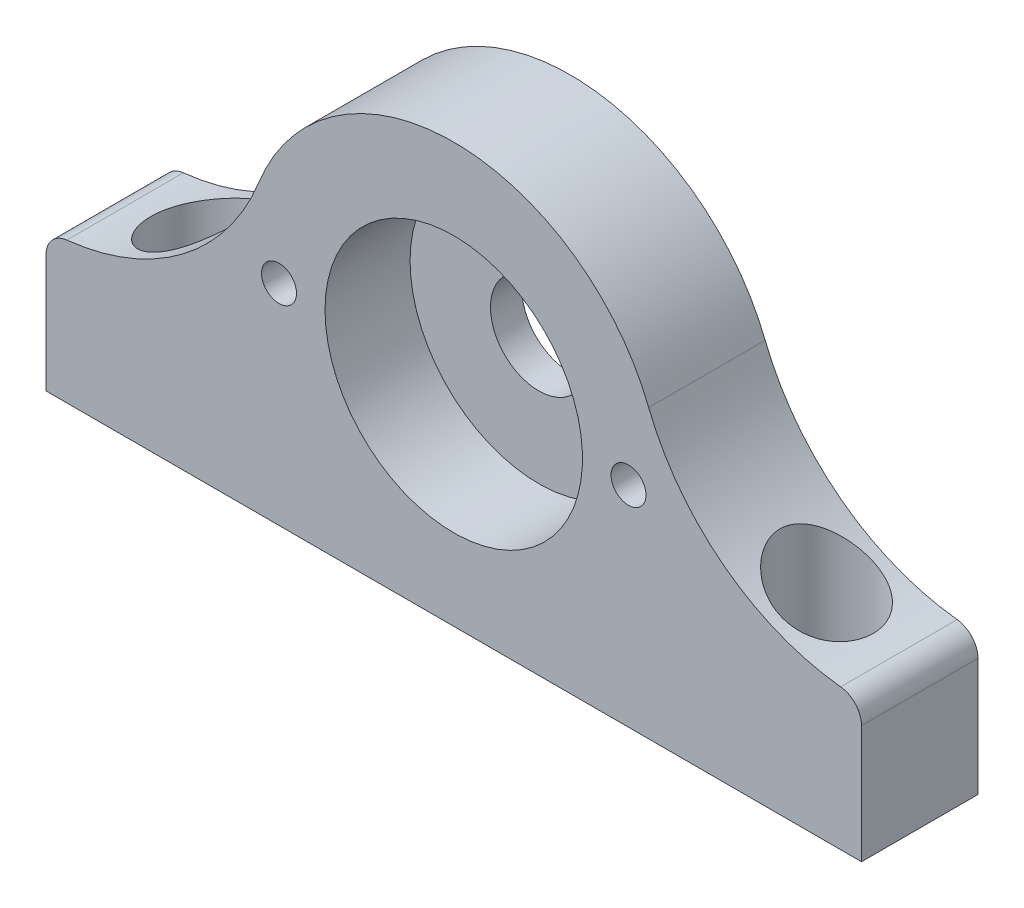
from build123d import *

# Parameters (mm, degrees)
BOSS_EXTRUDE1_DEPTH = 10
FILLET1_R           = 20
CUT_EXTRUDE1_START  = 10
SKETCH2_R           = 11.05
CUT_EXTRUDE1_DEPTH  = 7.3
SKETCH5_R           = 4.15
CUT_EXTRUDE2_DEPTH  = 10
FILLET2_R           = 2
CUT_EXTRUDE3_START  = 4
SKETCH6_R           = 4
CUT_EXTRUDE3_DEPTH  = 13
SKETCH7_R           = 2
CUT_EXTRUDE4_DEPTH  = 13
CUT_EXTRUDE5_START  = 10
SKETCH9_R           = 1.5
CUT_EXTRUDE5_DEPTH  = 7.5


with BuildPart() as part:
    # Sketch1 → Boss-Extrude1 (new body)
    with BuildSketch(Plane.XY):
        with BuildLine():
            Line((0, 12), (18.029437252, 12))
            ThreePointArc((18.029437252, 12), (35, 36), (51.970562748, 12))
            Line((51.970562748, 12), (70, 12))
            Line((70, 12), (70, 0))
            Line((70, 0), (0, 0))
            Line((0, 0), (0, 12))
        make_face()
    extrude(amount=BOSS_EXTRUDE1_DEPTH)

    # Fillet1
    # the kernel refuses this fillet: 20 mm, written as the material it adds along each edge
    with BuildSketch(Plane(origin=(18.029437252, 12, 0), x_dir=(-1, 0, 0), z_dir=(0, 0, 1))) as fillet1_piece_1:
        with BuildLine():
            CenterArc((18.357547265, -19.997308414), FILLET1_R, 90.94000812, 67.446084787)
            Line((-0.236194847, -12.630303986), (-0.608069689, -12.482963897))
            ThreePointArc((-0.608069689, -12.482963897), (0.626360574, -6.329073839), (-0.377123617, -0.133333333))
            Line((-0.377123617, -0.133333333), (0, 0.4))
            ThreePointArc((0, 0.4), (9.014718626, 0.4), (18.022875051, 0.399946168))
            Line((18.022875051, 0.399946168), (18.029437252, 0))
        make_face()
    extrude(amount=10)
    with BuildSketch(Plane(origin=(51.970562748, 12, 0), x_dir=(-0.018697377190164018, 0.9998251887636201, 0), z_dir=(0, 0, 1))) as fillet1_piece_2:
        with BuildLine():
            CenterArc((19.650574675, -18.728235378), FILLET1_R, 110.542563864, 67.446084787)
            Line((-0.337103189, -18.026285503), (-0.736856746, -18.012246506))
            ThreePointArc((-0.736856746, -18.012246506), (-0.56848167, -9.005663801), (-0.399930076, 0.007478951))
            Line((-0.399930076, 0.007478951), (0.140361248, 0.374564708))
            ThreePointArc((0.140361248, 0.374564708), (6.316256145, -0.74458816), (12.492151043, 0.374564708))
            Line((12.492151043, 0.374564708), (12.632512291, 0))
        make_face()
    extrude(amount=10)

    # Sketch2 → Cut-Extrude1 (cut)
    with BuildSketch(Plane.XY.offset(CUT_EXTRUDE1_START)):
        with Locations(Location((35, 18, 0), (0, 0, 180))):
            Circle(SKETCH2_R)
    extrude(amount=-CUT_EXTRUDE1_DEPTH, mode=Mode.SUBTRACT)

    # Sketch5 → Cut-Extrude2 (cut)
    with BuildSketch(Plane.XY):
        with Locations(Location((35, 18, 0), (0, 0, 180))):
            Circle(SKETCH5_R)
    extrude(amount=CUT_EXTRUDE2_DEPTH, mode=Mode.SUBTRACT)

    # Fillet2
    fillet2_edges = [part.edges().sort_by_distance(p)[0] for p in [
        (0, 12, 5),
        (70, 12, 5),
    ]]
    fillet(fillet2_edges, radius=FILLET2_R)

    # Sketch6 → Cut-Extrude3 (cut)
    with BuildSketch(Plane(origin=(0, 0, 0), x_dir=(1, 0, 0), z_dir=(0, 1, 0)).offset(CUT_EXTRUDE3_START)):
        with Locations(Location((8, -5, 0), (0, 0, 90))):
            Circle(SKETCH6_R)
        with Locations(Location((62, -5, 0), (0, 0, 90))):
            Circle(SKETCH6_R)
    extrude(amount=CUT_EXTRUDE3_DEPTH, mode=Mode.SUBTRACT)

    # Sketch7 → Cut-Extrude4 (cut)
    with BuildSketch(Plane(origin=(0, 0, 0), x_dir=(1, 0, 0), z_dir=(0, 1, 0))):
        with Locations(Location((8, -5, 0), (0, 0, 90))):
            Circle(SKETCH7_R)
        with Locations(Location((62, -5, 0), (0, 0, 90))):
            Circle(SKETCH7_R)
    extrude(amount=CUT_EXTRUDE4_DEPTH, mode=Mode.SUBTRACT)

    # Sketch9 → Cut-Extrude5 (cut)
    with BuildSketch(Plane.XY.offset(CUT_EXTRUDE5_START)):
        with Locations(Location((20, 18, 0), (0, 0, 180))):
            Circle(SKETCH9_R)
        with Locations(Location((50, 18, 0), (0, 0, 180))):
            Circle(SKETCH9_R)
    extrude(amount=-CUT_EXTRUDE5_DEPTH, mode=Mode.SUBTRACT)


solid = part.part
